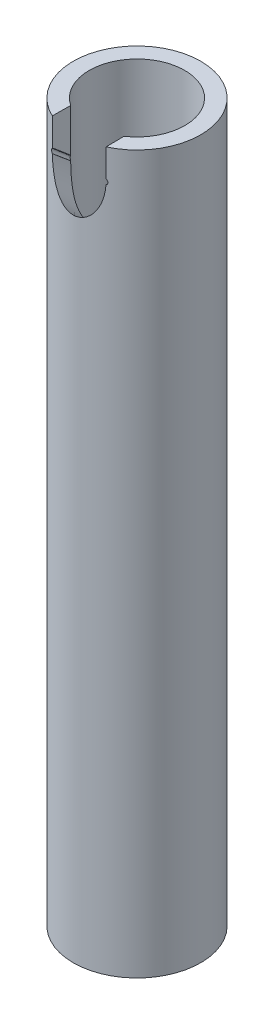
from build123d import *

# Parameters (mm, degrees)
BOSS_EXTRUDE2_DEPTH      = 350
BOSS_EXTRUDE2_DEPTH_BACK = 100
SKETCH12_R               = 40
SHELL1_T                 = -10


with BuildPart() as part:
    # Sketch12 → Boss-Extrude2 (new, two sides: drawn at the far end of the back side and taken through both)
    with BuildSketch(Plane(origin=(0, 0, 0), x_dir=(1, 0, 0), z_dir=(0, 1, 0)).offset(-BOSS_EXTRUDE2_DEPTH_BACK)):
        with Locations(Location((0, 0, 0), (0, 0, 270))):
            Circle(SKETCH12_R)
    extrude(amount=BOSS_EXTRUDE2_DEPTH + BOSS_EXTRUDE2_DEPTH_BACK)

    # Shell1
    shell1_openings = [part.faces().sort_by_distance(p)[0] for p in [
        (0, 350, 0),
    ]]
    offset(amount=SHELL1_T, openings=shell1_openings, kind=Kind.INTERSECTION)

    # Cut-Loft1: read off the stored shape, not the designer's step
    # Cut-Loft1: loft between two sections, ruled curve by curve
    cut_loft1_from = [
        Edge.make_bspline([(16.447768561, 299.687176089, 0.756078446), (16.559756866, 299.68551177, 0.757474976), (16.685169468, 299.695855255, 0.748795762), (16.948630904, 299.758019264, 0.696633965), (17.086724057, 299.810484473, 0.652610427), (17.338586824, 299.967314565, 0.521014355), (17.451178642, 300.072155873, 0.433042052), (17.606011876, 300.316064015, 0.22837882), (17.647058824, 300.454214414, 0.112456871), (17.647058824, 300.722256174, -0.112456871), (17.606011876, 300.860406573, -0.22837882), (17.451178642, 301.104314716, -0.433042052), (17.338586824, 301.209156023, -0.521014355), (17.086724057, 301.365986115, -0.652610427), (16.948630904, 301.418451325, -0.696633965), (16.685169468, 301.480615333, -0.748795762), (16.559756866, 301.490958819, -0.757474976), (16.447768561, 301.489294499, -0.756078446)], [0, 0, 0, 0, 0.125, 0.125, 0.25, 0.25, 0.375, 0.375, 0.5, 0.5, 0.625, 0.625, 0.75, 0.75, 0.875, 0.875, 1, 1, 1, 1], 3),
        Edge.make_bspline([(16.447768561, 301.489294499, -0.756078446), (14.881581053, 332.389152096, -26.684137559), (-14.881581053, 332.389152096, -26.684137559), (-16.447768561, 301.489294499, -0.756078446)], [0, 0, 0, 0, 1, 1, 1, 1], 3, [1, 0.368414451, 0.368414451, 1]),
        Edge.make_bspline([(-16.447768561, 299.687176089, 0.756078446), (-14.881581053, 268.787318493, 26.684137559), (14.881581053, 268.787318493, 26.684137559), (16.447768561, 299.687176089, 0.756078446)], [0, 0, 0, 0, 1, 1, 1, 1], 3, [1, 0.368414451, 0.368414451, 1]),
        Edge.make_bspline([(-16.447768561, 301.489294499, -0.756078446), (-16.559756866, 301.490958819, -0.757474976), (-16.685169468, 301.480615333, -0.748795762), (-16.948630904, 301.418451325, -0.696633965), (-17.086724057, 301.365986115, -0.652610427), (-17.338586824, 301.209156023, -0.521014355), (-17.451178642, 301.104314716, -0.433042052), (-17.606011876, 300.860406573, -0.22837882), (-17.647058824, 300.722256174, -0.112456871), (-17.647058824, 300.454214414, 0.112456871), (-17.606011876, 300.316064015, 0.22837882), (-17.451178642, 300.072155873, 0.433042052), (-17.338586824, 299.967314565, 0.521014355), (-17.086724057, 299.810484473, 0.652610427), (-16.948630904, 299.758019264, 0.696633965), (-16.685169468, 299.695855255, 0.748795762), (-16.559756866, 299.68551177, 0.757474976), (-16.447768561, 299.687176089, 0.756078446)], [0, 0, 0, 0, 0.125, 0.125, 0.25, 0.25, 0.375, 0.375, 0.5, 0.5, 0.625, 0.625, 0.75, 0.75, 0.875, 0.875, 1, 1, 1, 1], 3),
    ]
    cut_loft1_to = [
        Edge.make_bspline([(17.602105154, 396.042079443, 115.71580798), (17.609587889, 396.12223285, 115.648551286), (17.616135283, 396.20246302, 115.58123018), (17.627359386, 396.363038504, 115.44649135), (17.632036096, 396.443383819, 115.379073626), (17.639518831, 396.604151212, 115.244173766), (17.642324857, 396.68457329, 115.17669163), (17.646066225, 396.845455828, 115.041695152), (17.647001567, 396.925916287, 114.97418081), (17.647001567, 397.086837207, 114.839152126), (17.646066225, 397.167297667, 114.771637784), (17.642324857, 397.328180204, 114.636641306), (17.639518831, 397.408602282, 114.569159169), (17.632036096, 397.569369675, 114.434259309), (17.627359386, 397.64971499, 114.366841585), (17.616135283, 397.810290475, 114.232102756), (17.609587889, 397.890520644, 114.16478165), (17.602105154, 397.970674051, 114.097524956)], [0, 0, 0, 0, 0.125, 0.125, 0.25, 0.25, 0.375, 0.375, 0.5, 0.5, 0.625, 0.625, 0.75, 0.75, 0.875, 0.875, 1, 1, 1, 1], 3),
        Edge.make_bspline([(17.602105154, 397.970674051, 114.097524956), (15.404444247, 421.511531348, 94.34440028), (-15.404444247, 421.511531348, 94.34440028), (-17.602105154, 397.970674051, 114.097524956)], [0, 0, 0, 0, 1, 1, 1, 1], 3, [1, 0.380888028, 0.380888028, 1]),
        Edge.make_bspline([(-17.602105154, 396.042079443, 115.71580798), (-15.404444247, 372.501222146, 135.468932655), (15.404444247, 372.501222146, 135.468932655), (17.602105154, 396.042079443, 115.71580798)], [0, 0, 0, 0, 1, 1, 1, 1], 3, [1, 0.380888028, 0.380888028, 1]),
        Edge.make_bspline([(-17.602105154, 397.970674051, 114.097524956), (-17.609587889, 397.890520644, 114.16478165), (-17.616135283, 397.810290475, 114.232102756), (-17.627359386, 397.64971499, 114.366841585), (-17.632036096, 397.569369675, 114.434259309), (-17.639518831, 397.408602282, 114.569159169), (-17.642324857, 397.328180204, 114.636641306), (-17.646066225, 397.167297667, 114.771637784), (-17.647001567, 397.086837207, 114.839152126), (-17.647001567, 396.925916287, 114.97418081), (-17.646066225, 396.845455828, 115.041695152), (-17.642324857, 396.68457329, 115.17669163), (-17.639518831, 396.604151212, 115.244173766), (-17.632036096, 396.443383819, 115.379073626), (-17.627359386, 396.363038504, 115.44649135), (-17.616135283, 396.20246302, 115.58123018), (-17.609587889, 396.12223285, 115.648551286), (-17.602105154, 396.042079443, 115.71580798)], [0, 0, 0, 0, 0.125, 0.125, 0.25, 0.25, 0.375, 0.375, 0.5, 0.5, 0.625, 0.625, 0.75, 0.75, 0.875, 0.875, 1, 1, 1, 1], 3),
    ]
    cut_loft1 = Solid(Shell([*[Face.make_surface_from_curves(cut_loft1_from[k], cut_loft1_to[k]) for k in range(4)], Face(Wire(cut_loft1_from)), Face(Wire(cut_loft1_to))]))
    add(cut_loft1, mode=Mode.SUBTRACT)

    # Sketch15 → Cut-Loft3 section 0
    with BuildSketch(Plane.XY):
        with BuildLine():
            Line((-16.470588235, 350), (16.470588235, 350))
            Line((16.470588235, 350), (16.470588235, 300.588235294))
            Line((16.470588235, 300.588235294), (-16.470588235, 300.588235294))
            Line((-16.470588235, 300.588235294), (-16.470588235, 350))
        make_face()
    # Sketch20 → Cut-Loft3 section 1
    with BuildSketch(Plane(origin=(0, 397.006376747, 114.906666468), x_dir=(1, 0, 0), z_dir=(0, 0.6427876096865435, 0.7660444431189747))):
        with BuildLine():
            Line((-17.647058824, 0), (-17.647058824, 17.647058824))
            Line((-17.647058824, 17.647058824), (17.647058824, 17.647058824))
            Line((17.647058824, 17.647058824), (17.647058824, 0))
            ThreePointArc((17.647058824, 0), (0, -17.647058824), (-17.647058824, 0))
        make_face()
    loft(mode=Mode.SUBTRACT)


solid = part.part
